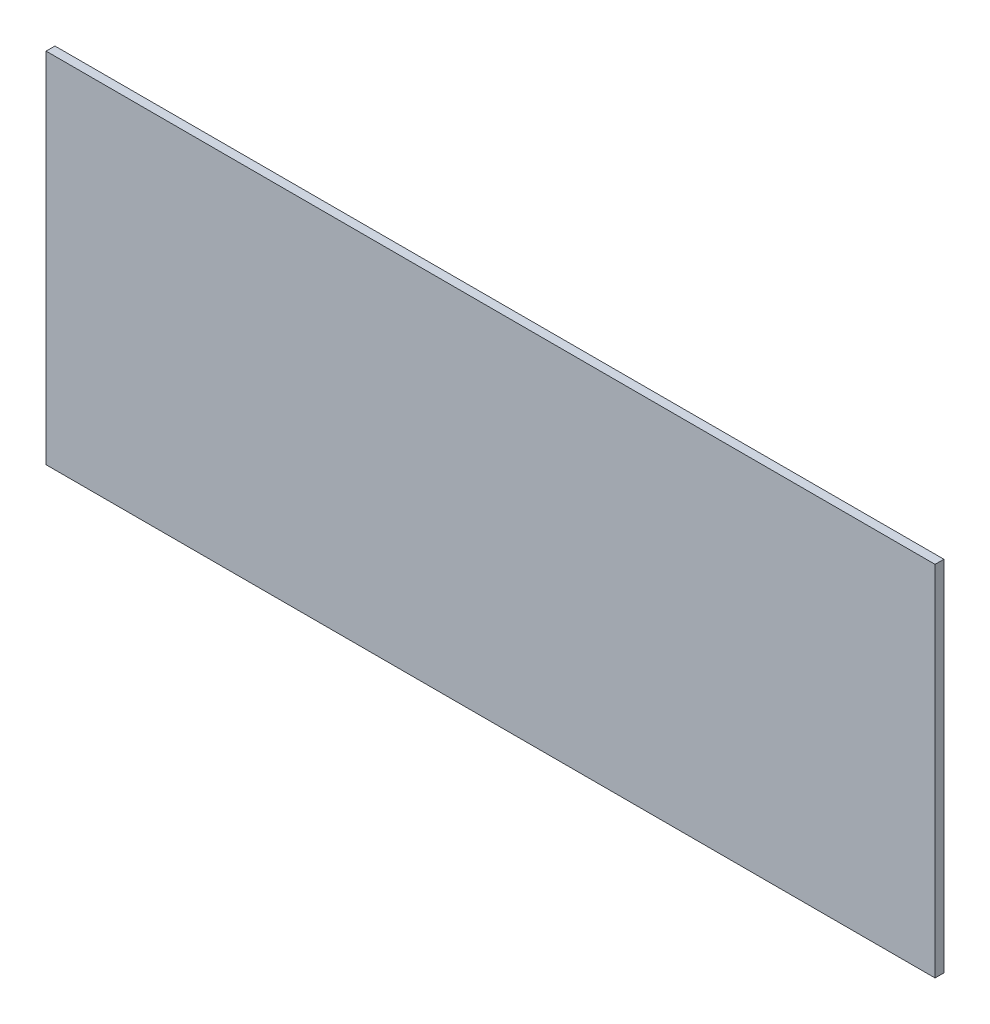
from build123d import *

# Parameters (mm, degrees)
SKIZZE1_W                       = 10050
SKIZZE1_H                       = 4050
AUFSATZ_LINEAR_AUSTRAGEN1_DEPTH = 100


with BuildPart() as part:
    # Skizze1 → Aufsatz-Linear austragen1 (new body)
    with BuildSketch(Plane.XY):
        with Locations((5025, 2025)):
            Rectangle(SKIZZE1_W, SKIZZE1_H)
    extrude(amount=AUFSATZ_LINEAR_AUSTRAGEN1_DEPTH)


solid = part.part
